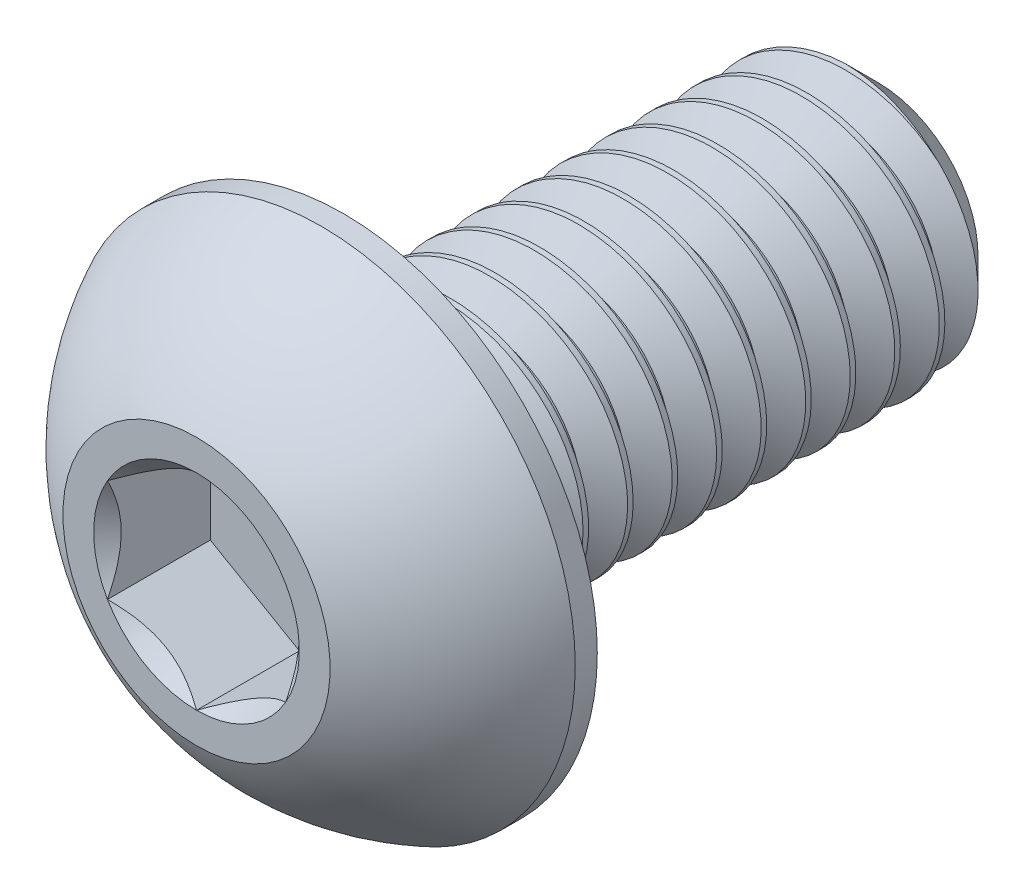
from build123d import *

# Parameters (mm, degrees)
SKETCH1_W          = 6
SKETCH1_H          = 1.5
CHAMFER1_SIZE      = 0.375
CUT_EXTRUDE2_DEPTH = 1.155
CUT_SWEEP1_PITCH   = 0.5


with BuildPart() as part:
    # Sketch1 → Revolve1 (revolve)
    with BuildSketch(Plane(origin=(0, 0, 0), x_dir=(0, 0, -1), z_dir=(1, 0, 0))):
        with Locations((4.65, 0.75)):
            Rectangle(SKETCH1_W, SKETCH1_H)
    revolve(axis=Axis((0, 0, -7.65), (0, 0, 1)))

    # Chamfer1
    chamfer1_edges = [part.edges().sort_by_distance(p)[0] for p in [
        (0, -1.5, -7.65),
    ]]
    chamfer(chamfer1_edges, length=CHAMFER1_SIZE)

    # Sketch7 → Revolve2 (revolve)
    with BuildSketch(Plane(origin=(0, 0, 0), x_dir=(0, 0, -1), z_dir=(1, 0, 0)), mode=Mode.PRIVATE) as revolve2_sk:
        with BuildLine():
            Line((1.4025, 2.85), (1.65, 2.85))
            Line((1.65, 2.85), (1.65, 0))
            Line((1.65, 0), (0, 0))
            Line((0, 0), (0, 1.5))
            ThreePointArc((0, 1.5), (0.59512511, 2.285251969), (1.4025, 2.85))
        make_face()
    revolve(revolve2_sk.sketch.rotate(Axis((0, 0, 0), (0, 0, -1)), 180), axis=Axis((0, 0, 0), (0, 0, -1)))

    # Sketch5 → Cut-Extrude2 (cut)
    with BuildSketch(Plane.XY):
        Polygon((1, -0.577350269), (1, 0.577350269), (0, 1.154700538), (-1, 0.577350269), (-1, -0.577350269), (0, -1.154700538), align=None)
    extrude(amount=-CUT_EXTRUDE2_DEPTH, mode=Mode.SUBTRACT)

    # Cut-Extrude3 cone 1 section (through the dimple's axis) → Cut-Extrude3 (revolve, cut)
    with BuildSketch(Plane(origin=(0, 0, 0), x_dir=(0, -1, 0), z_dir=(1, 0, 0))):
        Polygon((0, 0), (1.154700538, 0), (0, 1.154700538), align=None)
    revolve(axis=Axis((0, 0, 0), (0, 0, -1)), mode=Mode.SUBTRACT)

    # Cut-Sweep1: the profile of Sketch2 profile screwed along a right-hand helix of 13 turns, 6 arcs to a turn; built about Z, then put on its axis
    cut_sweep1_z = Axis((0, 0, 0), (0, 0, 1))
    cut_sweep1_corners = [(1.5003, 0, 0.375173205), (1.5003, 0, -0.062673205), (1.175240474, 0, 0.125), (1.175240474, 0, 0.1875)]
    with BuildLine(mode=Mode.PRIVATE) as cut_sweep1_profile:
        Line(cut_sweep1_corners[0], cut_sweep1_corners[1])
        Line(cut_sweep1_corners[1], cut_sweep1_corners[2])
        Line(cut_sweep1_corners[2], cut_sweep1_corners[3])
        Line(cut_sweep1_corners[3], cut_sweep1_corners[0])
    cut_sweep1_cap = Face(cut_sweep1_profile.wire())
    cut_sweep1_turn_angles = [0, 30, 60, 90, 120, 150, 180, 210, 240, 270, 300, 330, 360]
    cut_sweep1_turn_weights = [1, 0.8660254037844387, 1, 0.8660254037844387, 1, 0.8660254037844387, 1, 0.8660254037844387, 1, 0.8660254037844387, 1, 0.8660254037844387, 1]
    cut_sweep1_turn_rails = [Edge.make_bspline([Vector(p[0], p[1], 0).rotate(cut_sweep1_z, cut_sweep1_turn_angles[k]) / cut_sweep1_turn_weights[k] + Vector(0, 0, p[2] + CUT_SWEEP1_PITCH * cut_sweep1_turn_angles[k] / 360) for k in range(13)], [0, 0, 0, 1, 1, 2, 2, 3, 3, 4, 4, 5, 5, 6, 6, 6], 2, cut_sweep1_turn_weights) for p in cut_sweep1_corners]
    cut_sweep1_turn_sides = [Face.make_surface_from_curves(cut_sweep1_turn_rails[p[0]], cut_sweep1_turn_rails[p[1]]) for p in [(0, 1), (1, 2), (2, 3), (3, 0)]]
    cut_sweep1 = Plane(origin=(0, 0, -7.65), x_dir=(0, 1, 0), z_dir=(0, 0, 1)) * Solid(Shell([*[p.moved(Location((0, 0, CUT_SWEEP1_PITCH * i))) for i in range(13) for p in cut_sweep1_turn_sides], cut_sweep1_cap, cut_sweep1_cap.rotate(cut_sweep1_z, 4680).moved(Location((0, 0, CUT_SWEEP1_PITCH * 4680 / 360)))]))
    add(cut_sweep1, mode=Mode.SUBTRACT)


solid = part.part
